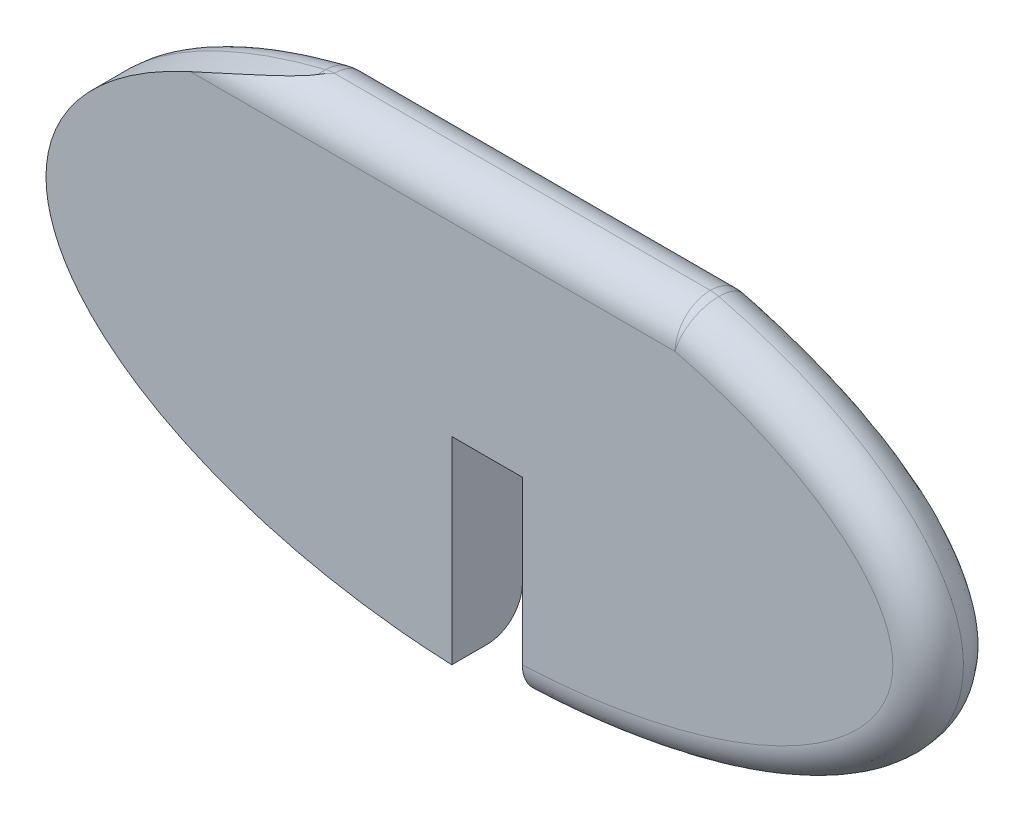
from build123d import *

# Parameters (mm, degrees)
BOSS_EXTRUDE1_DEPTH     = 4
CUT_EXTRUDE1_DEPTH      = 57.471231761
CUT_EXTRUDE1_DEPTH_BACK = 57.471231761
SKETCH2_W               = 8
SKETCH2_H               = 30
FILLET2_R               = 4


with BuildPart() as part:
    # Sketch1 → Boss-Extrude1 (new, symmetric)
    with BuildSketch(Plane.XY):
        with BuildLine():
            Line((21.794494718, 22.5), (-21.794494718, 22.5))
            add(Edge.make_bspline(
                [(-21.794494718, 22.5), (-78.136825066, 8.856081987), (-39.068412533, -15.601755848), (0, -40.059593683), (39.068412533, -15.601755848), (78.136825066, 8.856081987), (21.794494718, 22.5)],
                knots=[5.163415792, 5.163415792, 5.163415792, 6.957126353, 6.957126353, 8.750836915, 8.750836915, 10.544547476, 10.544547476, 10.544547476], degree=2, weights=[1, 0.624070234, 1, 0.624070234, 1, 0.624070234, 1]))
        make_face()
    extrude(amount=BOSS_EXTRUDE1_DEPTH, both=True)

    # Sketch2 → Cut-Extrude1 (cut, two sides: drawn at the far end of the back side and taken through both)
    with BuildSketch(Plane.XY.offset(4).offset(-CUT_EXTRUDE1_DEPTH_BACK)):
        with Locations((0, -17.5)):
            Rectangle(SKETCH2_W, SKETCH2_H)
    extrude(amount=CUT_EXTRUDE1_DEPTH + CUT_EXTRUDE1_DEPTH_BACK, mode=Mode.SUBTRACT)

    # Fillet2
    fillet2_edges = [part.edges().sort_by_distance(p)[0] for p in [
        (48.889100189, -5.240607854, 4),
        (0, 22.5, 4),
        (-48.889100189, -5.240607854, -4),
        (-21.794494718, 22.5, -2),
        (21.794494718, 22.5, -2),
        (0, 22.5, -4),
        (48.889100189, -5.240607854, -4),
    ]]
    fillet(fillet2_edges, radius=FILLET2_R - 0.0001)  # a hair under: the kernel refuses the full size


solid = part.part
